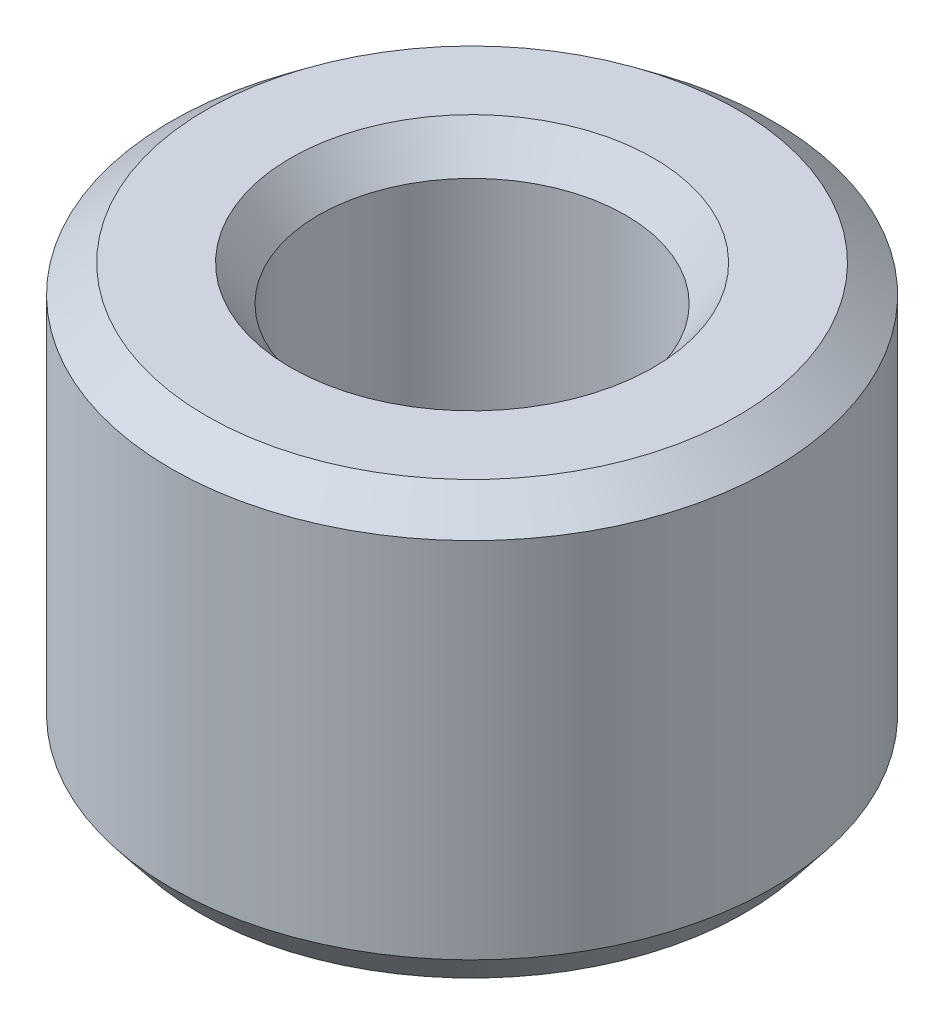
from build123d import *
from OCP.BRepFilletAPI import BRepFilletAPI_MakeChamfer

# Parameters (mm, degrees)
SKETCH1_R           = 30
BOSS_EXTRUDE1_DEPTH = 42.511503864
SKETCH2_R           = 15.304947825
CUT_EXTRUDE1_DEPTH  = 61.060202803
CHAMFER1_SIZE       = 2.780875648
CHAMFER1_SIZE2      = 3.535336561


with BuildPart() as part:
    # Sketch1 → Boss-Extrude1 (new body)
    with BuildSketch(Plane(origin=(0, 0, 0), x_dir=(1, 0, 0), z_dir=(0, 1, 0))):
        Circle(SKETCH1_R)
    extrude(amount=BOSS_EXTRUDE1_DEPTH)

    # Sketch2 → Cut-Extrude1 (cut, through all)
    with BuildSketch(Plane(origin=(0, 0, 0), x_dir=(1, 0, 0), z_dir=(0, 1, 0))):
        Circle(SKETCH2_R)
    extrude(amount=CUT_EXTRUDE1_DEPTH, mode=Mode.SUBTRACT)

    # Chamfer1: one chamfer whose edges measure the first distance from different faces: ONE call of the kernel's chamfer builder (chamfer() names one face for all edges)
    chamfer1_edges_1 = [part.edges().sort_by_distance(p)[0] for p in [
        (-15.304947825, 42.511503864, 0),
    ]]
    chamfer1_side_1 = [part.faces().sort_by_distance(p)[0] for p in [
        (-29.151471863, 42.511503864, 0),
    ]]
    chamfer1_edges_2 = [part.edges().sort_by_distance(p)[0] for p in [
        (-15.304947825, 0, 0),
    ]]
    chamfer1_side_2 = [part.faces().sort_by_distance(p)[0] for p in [
        (-15.304947825, 21.255751932, 0),
    ]]
    chamfer1_edges_3 = [part.edges().sort_by_distance(p)[0] for p in [
        (-30, 0, 0),
    ]]
    chamfer1_side_3 = [part.faces().sort_by_distance(p)[0] for p in [
        (-29.151471863, 0, 0),
    ]]
    chamfer1_edges_4 = [part.edges().sort_by_distance(p)[0] for p in [
        (-30, 42.511503864, 0),
    ]]
    chamfer1_side_4 = [part.faces().sort_by_distance(p)[0] for p in [
        (-30, 21.255751932, 0),
    ]]
    chamfer1 = BRepFilletAPI_MakeChamfer(part.part.solid().wrapped)
    for e in chamfer1_edges_1:
        chamfer1.Add(CHAMFER1_SIZE, CHAMFER1_SIZE2, e.wrapped, chamfer1_side_1[0].wrapped)  # the first distance lies on this face
    for e in chamfer1_edges_2:
        chamfer1.Add(CHAMFER1_SIZE, CHAMFER1_SIZE2, e.wrapped, chamfer1_side_2[0].wrapped)  # the first distance lies on this face
    for e in chamfer1_edges_3:
        chamfer1.Add(CHAMFER1_SIZE, CHAMFER1_SIZE2, e.wrapped, chamfer1_side_3[0].wrapped)  # the first distance lies on this face
    for e in chamfer1_edges_4:
        chamfer1.Add(CHAMFER1_SIZE, CHAMFER1_SIZE2, e.wrapped, chamfer1_side_4[0].wrapped)  # the first distance lies on this face
    add(Compound.cast(chamfer1.Shape()), mode=Mode.REPLACE)


solid = part.part
